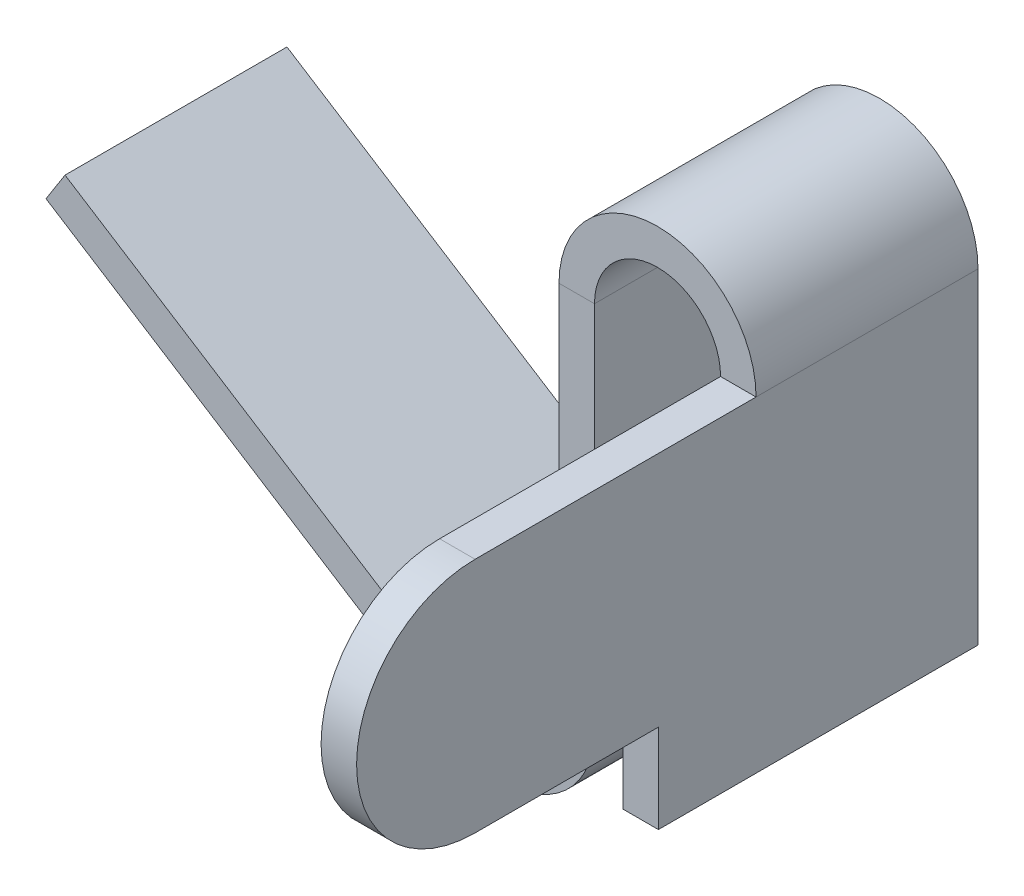
from build123d import *

# Parameters (mm, degrees)
BASE_FLANGE2_DEPTH  = 2.5
SKETCH10_W          = 0.4
SKETCH10_H          = 3.67
BOSS_EXTRUDE1_DEPTH = 4.5
SKETCH11_W          = 3.4
SKETCH11_H          = 1
CUT_EXTRUDE1_DEPTH  = 12.139958989
FILLET1_RADIUS      = 1.335
FILLET1_LENGTH      = 0.4


# Sheet-metal steps are written as plain solids
with BuildPart() as part:
    # Sketch1 → Base-Flange2 (new body)
    with BuildSketch(Plane.XY):
        with BuildLine():
            Line((-6.888528694, -0.229568793), (-2.246268811, -3.179047252))
            ThreePointArc((-2.246268811, -3.179047252), (-1.228475759, -3.211432773), (-0.71, -2.335))
            Line((-0.71, -2.335), (-0.71, -1.835))
            Line((-0.71, -1.835), (-0.71, 1.835))
            ThreePointArc((-0.71, 1.835), (0, 2.545), (0.71, 1.835))
            Line((0.71, 1.835), (0.71, -1.835))
            Line((0.71, -1.835), (1.11, -1.835))
            Line((1.11, -1.835), (1.11, 1.835))
            ThreePointArc((1.11, 1.835), (0, 2.945), (-1.11, 1.835))
            Line((-1.11, 1.835), (-1.11, -1.835))
            Line((-1.11, -1.835), (-1.11, -2.335))
            ThreePointArc((-1.11, -2.335), (-1.421085455, -2.860859664), (-2.031761286, -2.841428351))
            Line((-2.031761286, -2.841428351), (-6.67402117, 0.108050107))
            Line((-6.67402117, 0.108050107), (-6.888528694, -0.229568793))
        make_face()
    extrude(amount=BASE_FLANGE2_DEPTH)

    # Sketch10 → Boss-Extrude1 (add)
    with BuildSketch(Plane.XY.offset(2.5)):
        with Locations((0.91, 0)):
            Rectangle(SKETCH10_W, SKETCH10_H)
    extrude(amount=BOSS_EXTRUDE1_DEPTH)

    # Sketch11 → Cut-Extrude1 (cut, through all)
    with BuildSketch(Plane(origin=(1.11, 0, 0), x_dir=(0, 0, -1), z_dir=(1, 0, 0))):
        with Locations((-5.3, -1.335)):
            Rectangle(SKETCH11_W, SKETCH11_H)
    extrude(amount=-CUT_EXTRUDE1_DEPTH, mode=Mode.SUBTRACT)

    # Fillet1: full round fillet: the end face becomes a half cylinder, R = half its width
    fillet1_face = Plane((0.91, 0.5, 7), x_dir=(-1, 0, 0), z_dir=(0, 0, 1))  # on the end face: x along it, z out of the body
    fillet1_slab = fillet1_face.offset(-FILLET1_RADIUS / 2) * Box(FILLET1_LENGTH, 2 * FILLET1_RADIUS, FILLET1_RADIUS, mode=Mode.PRIVATE)  # the body's end, R deep
    fillet1_round = Plane((0.91, 0.5, 5.665), x_dir=(0, 0, 1), z_dir=(-1, 0, 0)) * Cylinder(FILLET1_RADIUS, FILLET1_LENGTH, mode=Mode.PRIVATE)  # its axis R under the face
    add(fillet1_slab - fillet1_round, mode=Mode.SUBTRACT)


solid = part.part
